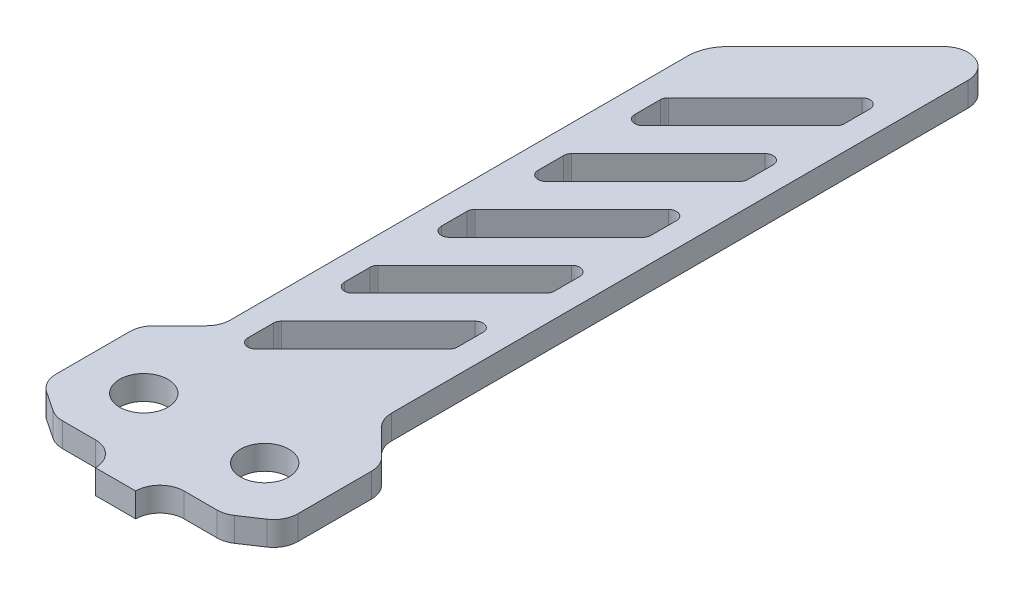
from build123d import *
from OCP.BRepFilletAPI import BRepFilletAPI_MakeFillet

# Parameters (mm, degrees)
BOSS_EXTRUDE1_DEPTH     = 1.5
CUT_EXTRUDE1_DEPTH      = 105.097310244
CUT_EXTRUDE2_DEPTH      = 105.097310244
CUT_EXTRUDE2_DEPTH_BACK = 105.097310244
SKETCH2_R               = 3
FILLET1_R               = 3
FILLET2_R               = 3
FILLET3_R1              = 5
FILLET3_R2              = 3
FILLET4_R               = 1
LPATTERN1_COUNT         = 5
LPATTERN1_PITCH         = 12
FILLET4_OF_LPATTERN1_R  = 1


with BuildPart() as part:
    # Sketch1 → Boss-Extrude1 (new, symmetric)
    with BuildSketch(Plane(origin=(0, 0, 0), x_dir=(1, 0, 0), z_dir=(0, 1, 0))):
        Polygon((-10, 83), (10, 103), (10, 23), (15, 18), (15, 6), (10.5, 3), (2.5, 3), (2.5, 0), (-2.5, 0), (-2.5, 3), (-10.5, 3), (-15, 6), (-15, 18), (-10, 23), align=None)
    extrude(amount=BOSS_EXTRUDE1_DEPTH, both=True)

    # Sketch1<3> → Cut-Extrude1 (cut, symmetric)
    with BuildSketch(Plane(origin=(0, 0, 0), x_dir=(1, 0, 0), z_dir=(0, 1, 0))):
        Polygon((7, 89), (-7, 75), (-7, 69), (7, 83), align=None)
    cut_extrude1 = extrude(amount=CUT_EXTRUDE1_DEPTH, both=True, mode=Mode.SUBTRACT)

    # Sketch2 → Cut-Extrude2 (cut, two sides: drawn at the far end of the back side and taken through both)
    with BuildSketch(Plane(origin=(0, 0, 0), x_dir=(1, 0, 0), z_dir=(0, 1, 0)).offset(-CUT_EXTRUDE2_DEPTH_BACK)):
        with Locations(Location((-7.5, 11, 0), (0, 0, 270))):
            Circle(SKETCH2_R)
        with Locations(Location((7.5, 11, 0), (0, 0, 270))):
            Circle(SKETCH2_R)
    extrude(amount=CUT_EXTRUDE2_DEPTH + CUT_EXTRUDE2_DEPTH_BACK, mode=Mode.SUBTRACT)

    # Fillet1
    fillet1_edges = [part.edges().sort_by_distance(p)[0] for p in [
        (2.5, 0, -3),
        (-2.5, 0, -3),
    ]]
    fillet(fillet1_edges, radius=FILLET1_R - 0.0001)  # a hair under: the kernel refuses the full size

    # Fillet2
    fillet2_edges = [part.edges().sort_by_distance(p)[0] for p in [
        (-10, 0, -23),
        (-15, 0, -18),
        (-15, 0, -6),
        (-10.5, 0, -3),
        (10.5, 0, -3),
        (15, 0, -6),
        (15, 0, -18),
        (10, 0, -23),
    ]]
    fillet(fillet2_edges, radius=FILLET2_R)

    # Fillet3: one fillet with a radius per group of edges: ONE call of the kernel's fillet builder (fillet() takes one radius for all edges)
    fillet3_edges_1 = [part.edges().sort_by_distance(p)[0] for p in [
        (-10, 0, -83),
    ]]
    fillet3_edges_2 = [part.edges().sort_by_distance(p)[0] for p in [
        (10, 0, -103),
    ]]
    fillet3 = BRepFilletAPI_MakeFillet(part.part.solid().wrapped)
    for e in fillet3_edges_1:
        fillet3.Add(FILLET3_R1, e.wrapped)
    for e in fillet3_edges_2:
        fillet3.Add(FILLET3_R2, e.wrapped)
    add(Compound.cast(fillet3.Shape()), mode=Mode.REPLACE)

    # Fillet4
    fillet4_edges = [part.edges().sort_by_distance(p)[0] for p in [
        (-7, 0, -69),
        (-7, 0, -75),
        (7, 0, -89),
        (7, 0, -83),
    ]]
    fillet(fillet4_edges, radius=FILLET4_R)

    # LPattern1: Cut-Extrude1 ×5
    with Locations(*[(0, 0, i * LPATTERN1_PITCH) for i in range(1, LPATTERN1_COUNT)]):
        add(cut_extrude1, mode=Mode.SUBTRACT)

    # Fillet4 of LPattern1
    fillet4_of_lpattern1_edges = [part.edges().sort_by_distance(p)[0] for p in [
        (-7, 0, -57),
        (-7, 0, -63),
        (7, 0, -77),
        (7, 0, -71),
        (-7, 0, -45),
        (-7, 0, -51),
        (7, 0, -65),
        (7, 0, -59),
        (-7, 0, -33),
        (-7, 0, -39),
        (7, 0, -53),
        (7, 0, -47),
        (-7, 0, -21),
        (-7, 0, -27),
        (7, 0, -41),
        (7, 0, -35),
    ]]
    fillet(fillet4_of_lpattern1_edges, radius=FILLET4_OF_LPATTERN1_R)


solid = part.part
